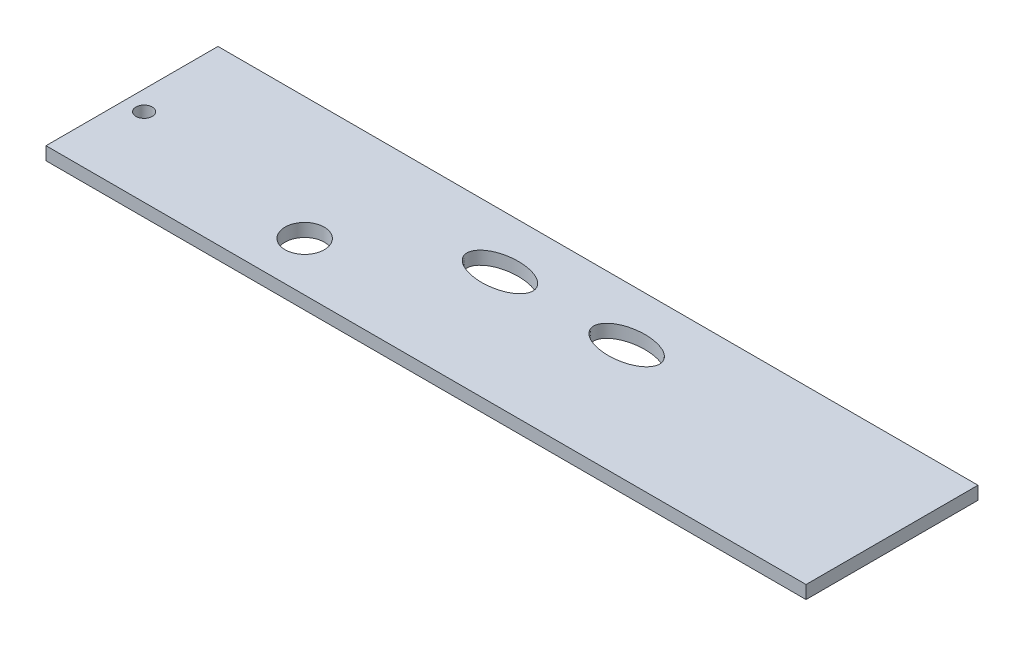
from build123d import *

# Parameters (mm, degrees)
SKETCH1_R           = 3
SKETCH1_R_2         = 1.25
BOSS_EXTRUDE1_DEPTH = 2


with BuildPart() as part:
    # Sketch1 → Boss-Extrude1 (new body)
    with BuildSketch(Plane(origin=(0, 0, 0), x_dir=(1, 0, 0), z_dir=(0, 1, 0))):
        Polygon((-71.199545455, 6.78030303), (45.040454545, 6.78030303), (45.040454545, -3.21969697), (45.040454545, -19.51969697), (-71.199545455, -19.51969697), (-71.199545455, -3.21969697), align=None)
        with Locations((-39.139545455, -12.01969697)):
            Circle(SKETCH1_R, mode=Mode.SUBTRACT)
        with Locations((-68.199545455, -7.51969697)):
            Circle(SKETCH1_R_2, mode=Mode.SUBTRACT)
        with BuildLine():
            add(Edge.make_bspline(
                [(-5.443545455, -1.51969697), (-5.443545455, -2.255899509), (-4.331482329, -3.728304587), (-0.393545455, -4.615393161), (3.54439142, -3.728304587), (5.212486108, -1.51969697), (3.54439142, 0.688910648), (-0.393545455, 1.575999221), (-4.331482329, 0.688910648), (-5.443545455, -0.78349443), (-5.443545455, -1.51969697)],
                knots=[0, 0, 0, 0, 0.785398163, 1.570796327, 2.35619449, 3.141592654, 3.926990817, 4.71238898, 5.497787144, 6.283185307, 6.283185307, 6.283185307, 6.283185307], degree=3))
        make_face(mode=Mode.SUBTRACT)
        with BuildLine():
            add(Edge.make_bspline(
                [(-24.815545455, -1.51969697), (-24.815545455, -2.255899509), (-23.703482329, -3.728304587), (-19.765545455, -4.615393161), (-15.82760858, -3.728304587), (-14.159513892, -1.51969697), (-15.82760858, 0.688910648), (-19.765545455, 1.575999221), (-23.703482329, 0.688910648), (-24.815545455, -0.78349443), (-24.815545455, -1.51969697)],
                knots=[0, 0, 0, 0, 0.785398163, 1.570796327, 2.35619449, 3.141592654, 3.926990817, 4.71238898, 5.497787144, 6.283185307, 6.283185307, 6.283185307, 6.283185307], degree=3))
        make_face(mode=Mode.SUBTRACT)
    extrude(amount=BOSS_EXTRUDE1_DEPTH)


solid = part.part
